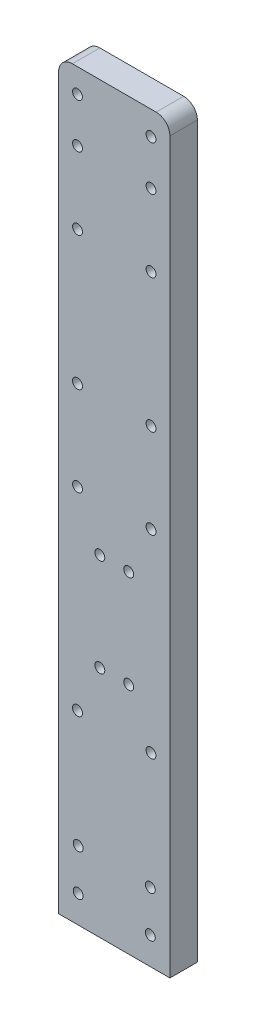
from build123d import *

# Parameters (mm, degrees)
SKETCH1_W           = 16.2
SKETCH1_H           = 108.14
SKETCH1_R           = 0.72
BOSS_EXTRUDE1_DEPTH = 4
FILLET1_R           = 2


with BuildPart() as part:
    # Sketch1 → Boss-Extrude1 (new body)
    with BuildSketch(Plane.XY):
        with Locations((8.1, 54.07)):
            Rectangle(SKETCH1_W, SKETCH1_H)
        with Locations((13.45, 55.21)):
            Circle(SKETCH1_R, mode=Mode.SUBTRACT)
        with Locations((10.2, 48.21)):
            Circle(SKETCH1_R, mode=Mode.SUBTRACT)
        with Locations((13.45, 104.66)):
            Circle(SKETCH1_R, mode=Mode.SUBTRACT)
        with Locations((2.75, 98.16)):
            Circle(SKETCH1_R, mode=Mode.SUBTRACT)
        with Locations((6, 48.21)):
            Circle(SKETCH1_R, mode=Mode.SUBTRACT)
        with Locations((2.75, 27)):
            Circle(SKETCH1_R, mode=Mode.SUBTRACT)
        with Locations((2.75, 87.66)):
            Circle(SKETCH1_R, mode=Mode.SUBTRACT)
        with Locations((2.75, 55.21)):
            Circle(SKETCH1_R, mode=Mode.SUBTRACT)
        with Locations((13.45, 87.66)):
            Circle(SKETCH1_R, mode=Mode.SUBTRACT)
        with Locations((13.45, 98.16)):
            Circle(SKETCH1_R, mode=Mode.SUBTRACT)
        with Locations((13.45, 68.21)):
            Circle(SKETCH1_R, mode=Mode.SUBTRACT)
        with Locations((6, 34)):
            Circle(SKETCH1_R, mode=Mode.SUBTRACT)
        with Locations((2.75, 104.66)):
            Circle(SKETCH1_R, mode=Mode.SUBTRACT)
        with Locations((10.2, 34)):
            Circle(SKETCH1_R, mode=Mode.SUBTRACT)
        with Locations((2.75, 68.21)):
            Circle(SKETCH1_R, mode=Mode.SUBTRACT)
        with Locations((13.45, 27)):
            Circle(SKETCH1_R, mode=Mode.SUBTRACT)
        with Locations((2.85, 10)):
            Circle(SKETCH1_R, mode=Mode.SUBTRACT)
        with Locations((13.35, 10)):
            Circle(SKETCH1_R, mode=Mode.SUBTRACT)
        with Locations((13.35, 4)):
            Circle(SKETCH1_R, mode=Mode.SUBTRACT)
        with Locations((2.85, 4)):
            Circle(SKETCH1_R, mode=Mode.SUBTRACT)
    extrude(amount=BOSS_EXTRUDE1_DEPTH)

    # Fillet1
    fillet1_edges = [part.edges().sort_by_distance(p)[0] for p in [
        (16.2, 108.14, 2),
        (0, 108.14, 2),
    ]]
    fillet(fillet1_edges, radius=FILLET1_R)


solid = part.part
